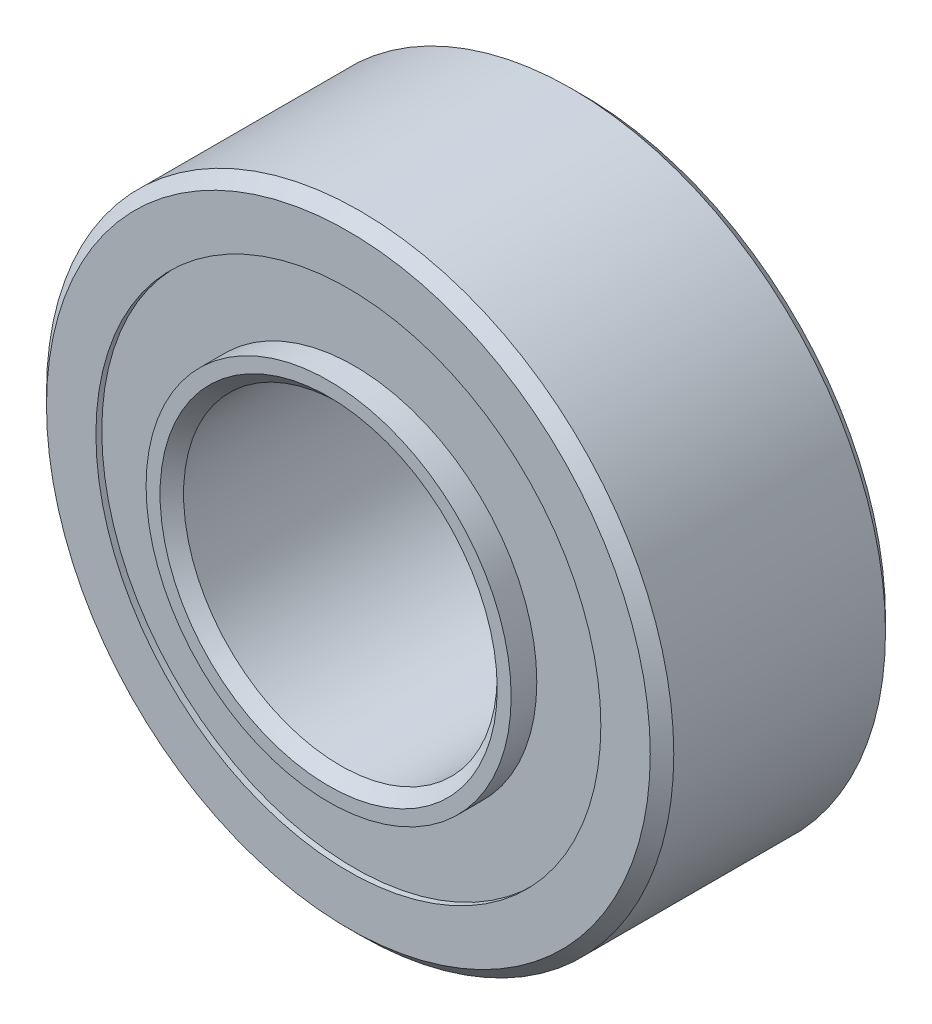
from build123d import *

# Parameters (mm, degrees)
CIRPATTERN1_COUNT = 10
SKETCH5_W         = 1.147826059
SKETCH5_H         = 1.415701099


with BuildPart() as part:
    # Sketch1 → Revolve1 (revolve)
    with BuildSketch(Plane(origin=(0, 0, 0), x_dir=(0, 0, -1), z_dir=(1, 0, 0))):
        with BuildLine():
            Line((2.143125, 6.35), (-2.143125, 6.35))
            Line((-2.143125, 6.35), (-2.38125, 6.111875))
            Line((-2.38125, 6.111875), (-2.38125, 5.111401099))
            Line((-2.38125, 5.111401099), (-1.058333333, 5.111401099))
            ThreePointArc((-1.058333333, 5.111401099), (0, 5.876861441), (1.058333333, 5.111401099))
            Line((1.058333333, 5.111401099), (2.38125, 5.111401099))
            Line((2.38125, 5.111401099), (2.38125, 6.111875))
            Line((2.38125, 6.111875), (2.143125, 6.35))
        make_face()
    revolve(axis=Axis((0, 0, 2.38125), (0, 0, -1)))


with BuildPart() as body_2:
    # Sketch3 → Revolve3 (revolve)
    with BuildSketch(Plane(origin=(0, 0, 0), x_dir=(0, 0, -1), z_dir=(1, 0, 0))):
        Polygon((-2.7813, 3.413125), (-2.7813, 3.6957), (2.7813, 3.6957), (2.7813, 3.413125), (2.543175, 3.175), (-2.543175, 3.175), align=None)
    revolve(axis=Axis((0, 0, 2.38125), (0, 0, -1)))


with BuildPart() as body_3:
    # Sketch4 → Revolve4 (revolve)
    with BuildSketch(Plane(origin=(0, 0, 0), x_dir=(0, 0, -1), z_dir=(1, 0, 0))):
        with BuildLine():
            Line((-1.114361441, 4.7625), (1.114361441, 4.7625))
            ThreePointArc((1.114361441, 4.7625), (0, 5.876861441), (-1.114361441, 4.7625))
        make_face()
    revolve(axis=Axis((0, 4.7625, 1.114361441), (0, 0, -1)))


with BuildPart() as cirpattern1_1:
    # CirPattern1: pattern copy
    add(body_3.part.rotate(Axis((0, 0, -2.38125), (0, 0, 1)), 1 * 360 / CIRPATTERN1_COUNT))


with BuildPart() as cirpattern1_2:
    # CirPattern1: pattern copy
    add(body_3.part.rotate(Axis((0, 0, -2.38125), (0, 0, 1)), 2 * 360 / CIRPATTERN1_COUNT))


with BuildPart() as cirpattern1_3:
    # CirPattern1: pattern copy
    add(body_3.part.rotate(Axis((0, 0, -2.38125), (0, 0, 1)), 3 * 360 / CIRPATTERN1_COUNT))


with BuildPart() as cirpattern1_4:
    # CirPattern1: pattern copy
    add(body_3.part.rotate(Axis((0, 0, -2.38125), (0, 0, 1)), 4 * 360 / CIRPATTERN1_COUNT))


with BuildPart() as cirpattern1_5:
    # CirPattern1: pattern copy
    add(body_3.part.rotate(Axis((0, 0, -2.38125), (0, 0, 1)), 5 * 360 / CIRPATTERN1_COUNT))


with BuildPart() as cirpattern1_6:
    # CirPattern1: pattern copy
    add(body_3.part.rotate(Axis((0, 0, -2.38125), (0, 0, 1)), 6 * 360 / CIRPATTERN1_COUNT))


with BuildPart() as cirpattern1_7:
    # CirPattern1: pattern copy
    add(body_3.part.rotate(Axis((0, 0, -2.38125), (0, 0, 1)), 7 * 360 / CIRPATTERN1_COUNT))


with BuildPart() as cirpattern1_8:
    # CirPattern1: pattern copy
    add(body_3.part.rotate(Axis((0, 0, -2.38125), (0, 0, 1)), 8 * 360 / CIRPATTERN1_COUNT))


with BuildPart() as cirpattern1_9:
    # CirPattern1: pattern copy
    add(body_3.part.rotate(Axis((0, 0, -2.38125), (0, 0, 1)), 9 * 360 / CIRPATTERN1_COUNT))


with BuildPart() as body_13:
    # Sketch5 → Revolve5 (revolve)
    with BuildSketch(Plane(origin=(0, 0, 0), x_dir=(0, 0, -1), z_dir=(1, 0, 0))):
        with Locations((-1.688274471, 4.40355055)):
            Rectangle(SKETCH5_W, SKETCH5_H)
        with Locations((1.688274471, 4.40355055)):
            Rectangle(SKETCH5_W, SKETCH5_H)
    revolve(axis=Axis((0, 0, 2.38125), (0, 0, -1)))


solid = Compound([part.part, body_2.part, body_3.part, cirpattern1_1.part, cirpattern1_2.part, cirpattern1_3.part, cirpattern1_4.part, cirpattern1_5.part, cirpattern1_6.part, cirpattern1_7.part, cirpattern1_8.part, cirpattern1_9.part, body_13.part])
